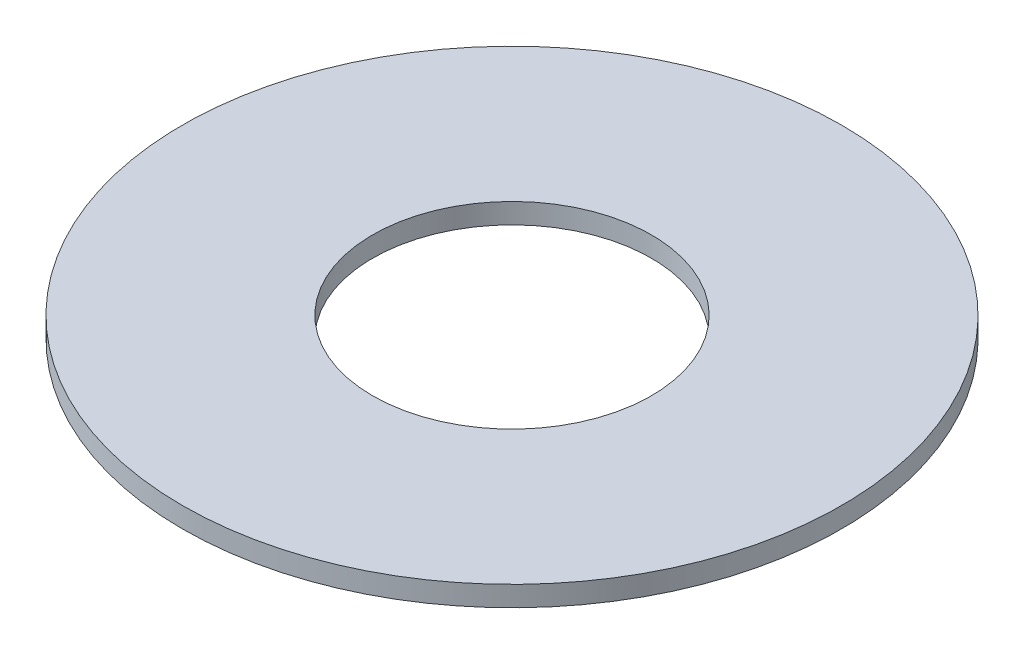
from build123d import *

# Parameters (mm, degrees)
SKETCH1_R           = 65
BOSS_EXTRUDE1_DEPTH = 4
SKETCH2_R           = 27.5
CUT_EXTRUDE1_DEPTH  = 93.010868923


with BuildPart() as part:
    # Sketch1 → Boss-Extrude1 (new body)
    with BuildSketch(Plane(origin=(0, 0, 0), x_dir=(1, 0, 0), z_dir=(0, 1, 0))):
        Circle(SKETCH1_R)
    extrude(amount=BOSS_EXTRUDE1_DEPTH)

    # Sketch2 → Cut-Extrude1 (cut, through all)
    with BuildSketch(Plane(origin=(0, 0, 0), x_dir=(1, 0, 0), z_dir=(0, 1, 0))):
        Circle(SKETCH2_R)
    extrude(amount=CUT_EXTRUDE1_DEPTH, mode=Mode.SUBTRACT)


solid = part.part
